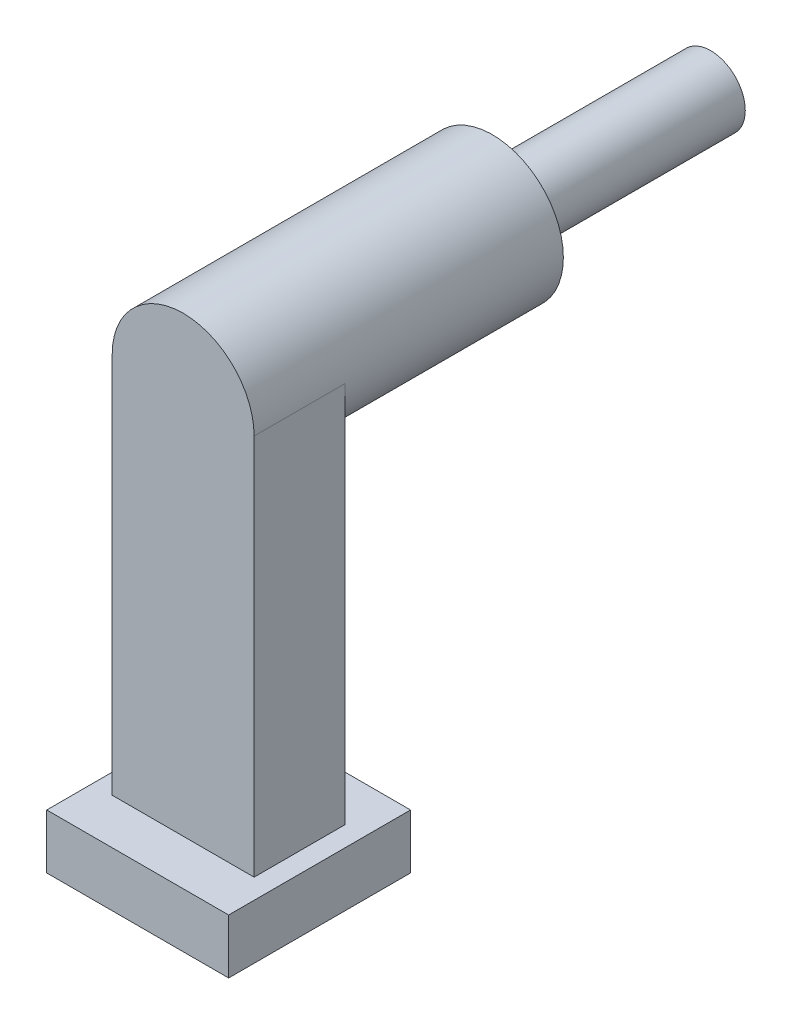
from build123d import *

# Parameters (mm, degrees)
BOSS_EXTRUDE1_START = 1
SKETCH1_R           = 1.9
BOSS_EXTRUDE1_DEPTH = 12
BOSS_EXTRUDE2_START = 13
SKETCH2_R           = 3.9
BOSS_EXTRUDE2_DEPTH = 17
SKETCH6_W           = 7.8
SKETCH6_H           = 5
BOSS_EXTRUDE3_DEPTH = 21
SKETCH7_W           = 10
SKETCH7_H           = 10
BOSS_EXTRUDE4_DEPTH = 3


with BuildPart() as part:
    # Sketch1 → Boss-Extrude1 (new body)
    with BuildSketch(Plane.XY.offset(BOSS_EXTRUDE1_START)):
        Circle(SKETCH1_R)
    extrude(amount=BOSS_EXTRUDE1_DEPTH)

    # Sketch2 → Boss-Extrude2 (add)
    with BuildSketch(Plane.XY.offset(BOSS_EXTRUDE2_START)):
        Circle(SKETCH2_R)
    extrude(amount=BOSS_EXTRUDE2_DEPTH)

    # Sketch6 → Boss-Extrude3 (add)
    with BuildSketch(Plane(origin=(0, 0, 0), x_dir=(1, 0, 0), z_dir=(0, 1, 0))):
        with Locations((0, -27.5)):
            Rectangle(SKETCH6_W, SKETCH6_H)
    extrude(amount=-BOSS_EXTRUDE3_DEPTH)

    # Sketch7 → Boss-Extrude4 (add)
    with BuildSketch(Plane.XZ.offset(21)):
        with Locations((0, 27.5)):
            Rectangle(SKETCH7_W, SKETCH7_H)
    extrude(amount=BOSS_EXTRUDE4_DEPTH)


solid = part.part
